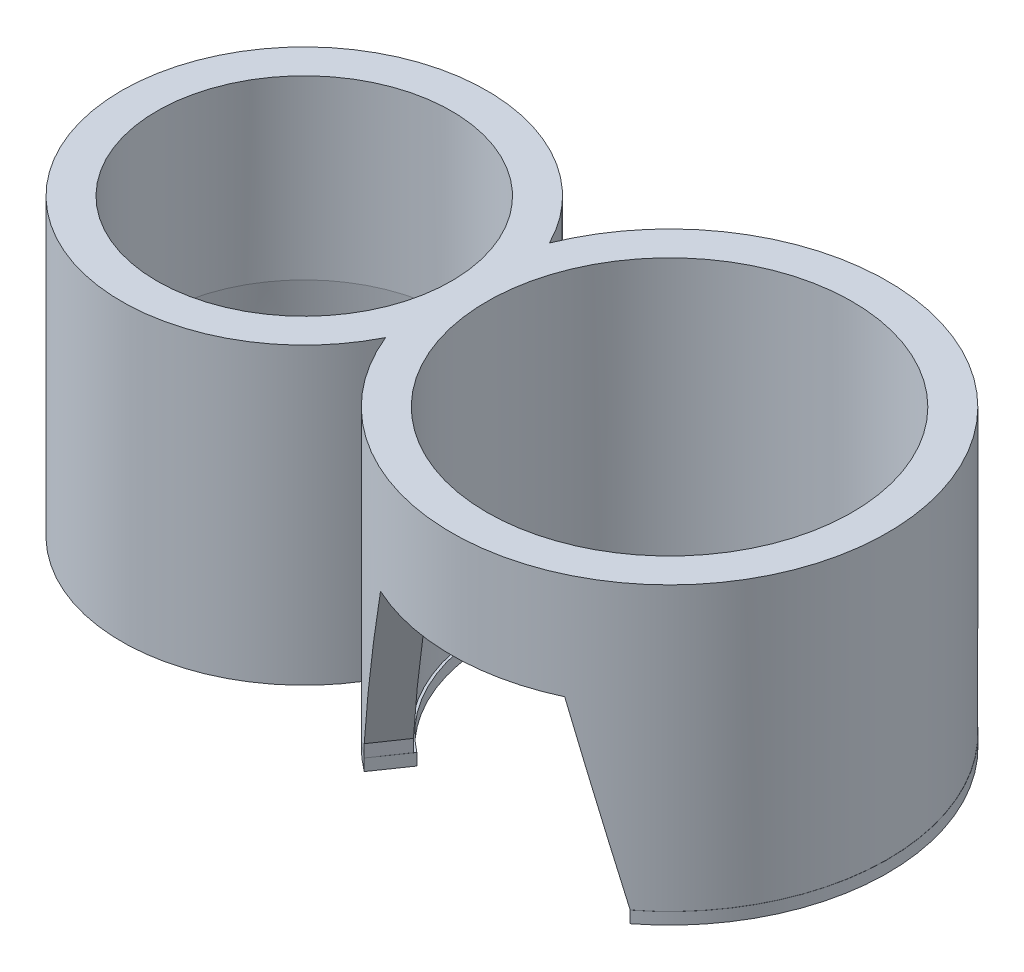
from build123d import *

# Parameters (mm, degrees)
BOSS_EXTRU_6_DEPTH      = 24
BOSS_EXTRU_6_DEPTH_BACK = 1
ESQUISSE2_R             = 15.5
ESQUISSE2_R_2           = 12.5
ESQUISSE3_R             = 18.5
ESQUISSE3_R_2           = 15.5
BOSS_EXTRU_7_DEPTH      = 24
ENL_V_MAT_EXTRU_4_DEPTH = 15
CHANFREIN3_SIZE         = 10
CHANFREIN3_SIZE2        = 0.874886635
CHANFREIN4_SIZE         = 4
CHANFREIN4_SIZE2        = 13.949657775
CHANFREIN5_SIZE         = 4
CHANFREIN5_SIZE2        = 14.92820323
BOSS_EXTRU_9_DEPTH      = 1


with BuildPart() as part:
    # Esquisse2 → Boss.-Extru.6 (new, two sides: drawn at the far end of the back side and taken through both)
    with BuildSketch(Plane(origin=(0, 0, 0), x_dir=(1, 0, 0), z_dir=(0, 1, 0)).offset(-BOSS_EXTRU_6_DEPTH_BACK)):
        Circle(ESQUISSE2_R)
        Circle(ESQUISSE2_R_2, mode=Mode.SUBTRACT)
    extrude(amount=BOSS_EXTRU_6_DEPTH + BOSS_EXTRU_6_DEPTH_BACK)

    # Esquisse3 → Boss.-Extru.7 (add)
    with BuildSketch(Plane(origin=(0, 0, 0), x_dir=(1, 0, 0), z_dir=(0, 1, 0))):
        with Locations((31, 0)):
            Circle(ESQUISSE3_R)
        with Locations((31, 0)):
            Circle(ESQUISSE3_R_2, mode=Mode.SUBTRACT)
    extrude(amount=BOSS_EXTRU_7_DEPTH)

    # Esquisse6 → Enlèv. mat.-Extru.4 (cut)
    with BuildSketch(Plane(origin=(0, 0, 0), x_dir=(1, 0, 0), z_dir=(0, 1, 0))):
        with BuildLine():
            ThreePointArc((40.457589045, -12.280228396), (31, -15.5), (21.542410955, -12.280228396))
            Line((21.542410955, -12.280228396), (19.846119293, -14.759435801))
            ThreePointArc((19.846119293, -14.759435801), (31.084403323, -18.499807461), (42.288090151, -14.657046795))
            Line((42.288090151, -14.657046795), (40.457589045, -12.280228396))
        make_face()
    extrude(amount=ENL_V_MAT_EXTRU_4_DEPTH, mode=Mode.SUBTRACT)

    # Chanfrein3
    chanfrein3_edges = [part.edges().sort_by_distance(p)[0] for p in [
        (-12.5, -1, 0),
    ]]
    chanfrein3_side = [part.faces().sort_by_distance(p)[0] for p in [
        (-12.5, 11.5, 0),
    ]]
    chamfer(chanfrein3_edges, length=CHANFREIN3_SIZE, length2=CHANFREIN3_SIZE2, reference=chanfrein3_side[0])

    # Chanfrein4
    chanfrein4_edges = [part.edges().sort_by_distance(p)[0] for p in [
        (20.694265124, 15, 13.519832098),
    ]]
    chanfrein4_side = [part.faces().sort_by_distance(p)[0] for p in [
        (31.040377675, 15, 15.854130796),
    ]]
    chamfer(chanfrein4_edges, length=CHANFREIN4_SIZE, length2=CHANFREIN4_SIZE2, reference=chanfrein4_side[0])

    # Chanfrein5
    chanfrein5_edges = [part.edges().sort_by_distance(p)[0] for p in [
        (41.372839598, 15, 13.468637595),
    ]]
    chanfrein5_side = [part.faces().sort_by_distance(p)[0] for p in [
        (32.951306309, 15, 16.129493261),
    ]]
    chamfer(chanfrein5_edges, length=CHANFREIN5_SIZE, length2=CHANFREIN5_SIZE2, reference=chanfrein5_side[0])

    # Esquisse18 → Boss.-Extru.9 (add)
    with BuildSketch(Plane(origin=(0, 0, 0), x_dir=(1, 0, 0), z_dir=(0, 1, 0))):
        with BuildLine():
            Line((40.360227094, -12.108845331), (42.293943816, -14.6646475))
            ThreePointArc((42.293943816, -14.6646475), (30.929770772, 18.504604183), (19.846119293, -14.759435801))
            Line((19.846119293, -14.759435801), (21.667455033, -12.118000277))
            ThreePointArc((21.667455033, -12.118000277), (31.000415105, 15.299998165), (40.360227094, -12.108845331))
        make_face()
    extrude(amount=-BOSS_EXTRU_9_DEPTH)


solid = part.part
